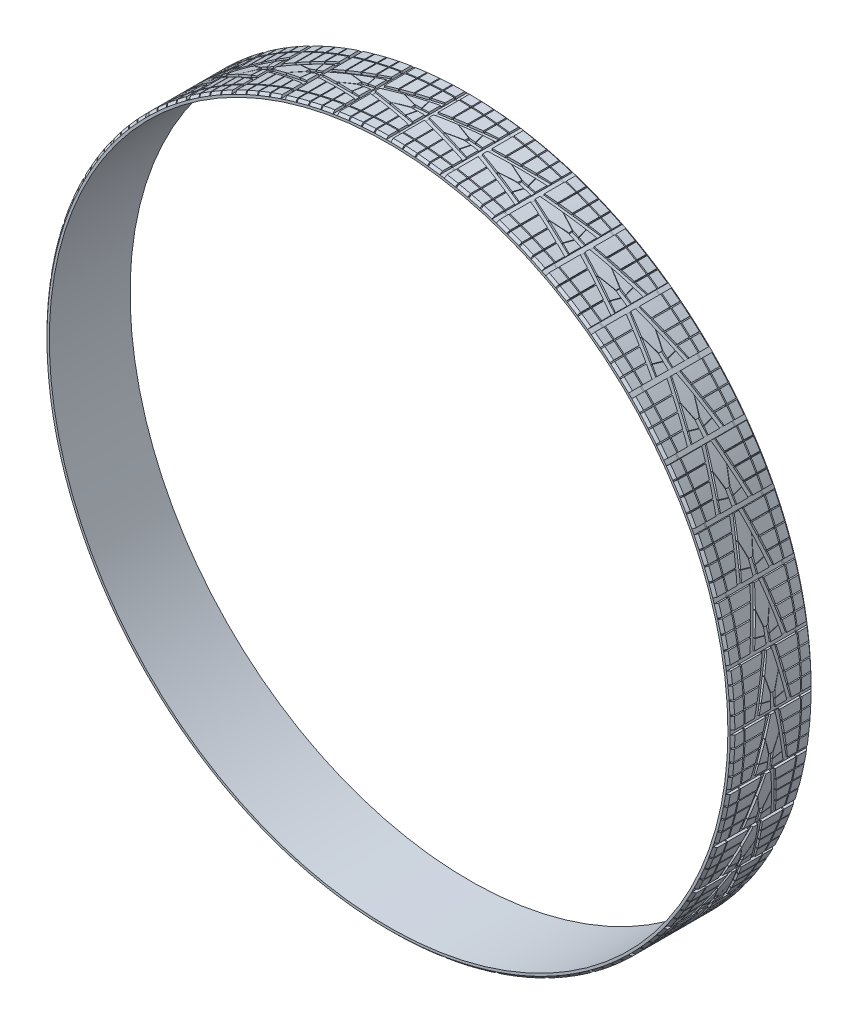
from build123d import *

# Parameters (mm, degrees)
SKETCH_1_R               = 149
SKETCH_1_R_2             = 147
EXTRUDE_1_DEPTH          = 35
CHAMFER_1_SIZE           = 1
SKETCH_2_W               = 2
SKETCH_2_H               = 2
CUT_EXTRUDE_1_DEPTH      = 214.604775228
SKETCH_3_R               = 149
SKETCH_3_R_2             = 148
CUT_EXTRUDE_2_DEPTH      = 0.5
CUT_EXTRUDE_START        = -0.5
SKETCH_4_R               = 149
SKETCH_4_R_2             = 148
CUT_EXTRUDE_3_DEPTH      = 0.5
SKETCH_5_W               = 6
SKETCH_5_H               = 2
CUT_EXTRUDE_4_DEPTH      = 1
CUT_EXTRUDE_5_DEPTH      = 1
PATTERN_CIRCULAR_1_COUNT = 40


with BuildPart() as part:
    # 草图1 → 拉伸-薄壁1 (new body)
    with BuildSketch(Plane.XY):
        Circle(SKETCH_1_R)
        Circle(SKETCH_1_R_2, mode=Mode.SUBTRACT)
    extrude(amount=EXTRUDE_1_DEPTH)

    # 倒角1
    chamfer_1_edges = [part.edges().sort_by_distance(p)[0] for p in [
        (-149, 0, 0),
        (-149, 0, 35),
    ]]
    chamfer(chamfer_1_edges, length=CHAMFER_1_SIZE)

    # 草图2 → 切除-拉伸1 (cut, through all)
    with BuildSketch(Plane(origin=(0, 0, 0), x_dir=(-1, 0, 0), z_dir=(0, 0, -1))):
        with Locations((0, 149)):
            Rectangle(SKETCH_2_W, SKETCH_2_H)
        Polygon((22.477481415, 148.309685554), (22.164612485, 146.334308873), (24.139989167, 146.021439943), (24.452858097, 147.996816624), align=None)
        Polygon((45.40149264, 142.967494439), (44.783458651, 141.065381406), (46.685571684, 140.447347417), (47.303605673, 142.34946045), align=None)
        Polygon((67.207568437, 134.104969128), (66.299587437, 132.32295608), (68.081600486, 131.41497508), (68.989581485, 133.196988129), align=None)
        Polygon((87.35877085, 121.940334409), (86.183200345, 120.32230042), (87.801234334, 119.146729915), (88.976804838, 120.764763904), align=None)
        Polygon((105.358910397, 106.773123959), (103.944696834, 105.358910397), (105.358910397, 103.944696834), (106.773123959, 105.358910397), align=None)
        Polygon((120.764763904, 88.976804838), (119.146729915, 87.801234334), (120.32230042, 86.183200345), (121.940334409, 87.35877085), align=None)
        Polygon((133.196988129, 68.989581485), (131.41497508, 68.081600486), (132.32295608, 66.299587437), (134.104969128, 67.207568437), align=None)
        Polygon((142.34946045, 47.303605673), (140.447347417, 46.685571684), (141.065381406, 44.783458651), (142.967494439, 45.40149264), align=None)
        Polygon((147.996816624, 24.452858097), (146.021439943, 24.139989167), (146.334308873, 22.164612485), (148.309685554, 22.477481415), align=None)
        with Locations((149, 0)):
            Rectangle(SKETCH_2_W, SKETCH_2_H)
        Polygon((148.309685554, -22.477481415), (146.334308873, -22.164612485), (146.021439943, -24.139989166), (147.996816624, -24.452858097), align=None)
        Polygon((142.967494439, -45.40149264), (141.065381406, -44.783458651), (140.447347417, -46.685571684), (142.34946045, -47.303605672), align=None)
        Polygon((134.104969128, -67.207568437), (132.32295608, -66.299587437), (131.41497508, -68.081600486), (133.196988129, -68.989581485), align=None)
        Polygon((121.940334409, -87.358770849), (120.32230042, -86.183200345), (119.146729915, -87.801234334), (120.764763904, -88.976804838), align=None)
        Polygon((106.773123959, -105.358910397), (105.358910397, -103.944696834), (103.944696835, -105.358910397), (105.358910397, -106.773123959), align=None)
        Polygon((88.976804838, -120.764763904), (87.801234334, -119.146729915), (86.183200345, -120.32230042), (87.35877085, -121.940334409), align=None)
        Polygon((68.989581485, -133.196988128), (68.081600486, -131.41497508), (66.299587437, -132.32295608), (67.207568437, -134.104969128), align=None)
        Polygon((47.303605673, -142.34946045), (46.685571684, -140.447347417), (44.783458651, -141.065381406), (45.40149264, -142.967494439), align=None)
        Polygon((24.452858097, -147.996816624), (24.139989167, -146.021439943), (22.164612485, -146.334308873), (22.477481416, -148.309685554), align=None)
        with Locations((0, -149)):
            Rectangle(SKETCH_2_W, SKETCH_2_H)
        Polygon((-22.477481415, -148.309685554), (-22.164612485, -146.334308873), (-24.139989166, -146.021439943), (-24.452858097, -147.996816624), align=None)
        Polygon((-45.40149264, -142.967494439), (-44.783458651, -141.065381406), (-46.685571684, -140.447347417), (-47.303605672, -142.34946045), align=None)
        Polygon((-67.207568437, -134.104969128), (-66.299587437, -132.32295608), (-68.081600486, -131.41497508), (-68.989581485, -133.196988129), align=None)
        Polygon((-87.358770849, -121.940334409), (-86.183200345, -120.32230042), (-87.801234334, -119.146729915), (-88.976804838, -120.764763904), align=None)
        Polygon((-105.358910397, -106.773123959), (-103.944696834, -105.358910397), (-105.358910397, -103.944696834), (-106.773123959, -105.358910397), align=None)
        Polygon((-120.764763904, -88.976804838), (-119.146729915, -87.801234334), (-120.32230042, -86.183200345), (-121.940334408, -87.35877085), align=None)
        Polygon((-133.196988128, -68.989581485), (-131.41497508, -68.081600486), (-132.32295608, -66.299587437), (-134.104969128, -67.207568437), align=None)
        Polygon((-142.34946045, -47.303605673), (-140.447347417, -46.685571684), (-141.065381406, -44.783458651), (-142.967494439, -45.40149264), align=None)
        Polygon((-147.996816624, -24.452858097), (-146.021439943, -24.139989167), (-146.334308873, -22.164612485), (-148.309685554, -22.477481415), align=None)
        with Locations((-149, 0)):
            Rectangle(SKETCH_2_W, SKETCH_2_H)
        Polygon((-148.309685554, 22.477481415), (-146.334308873, 22.164612485), (-146.021439943, 24.139989166), (-147.996816624, 24.452858097), align=None)
        Polygon((-142.967494439, 45.40149264), (-141.065381406, 44.783458651), (-140.447347417, 46.685571684), (-142.34946045, 47.303605672), align=None)
        Polygon((-134.104969128, 67.207568437), (-132.32295608, 66.299587437), (-131.41497508, 68.081600486), (-133.196988128, 68.989581485), align=None)
        Polygon((-121.940334409, 87.358770849), (-120.32230042, 86.183200345), (-119.146729915, 87.801234334), (-120.764763904, 88.976804838), align=None)
        Polygon((-106.773123959, 105.358910397), (-105.358910397, 103.944696834), (-103.944696834, 105.358910397), (-105.358910397, 106.773123959), align=None)
        Polygon((-88.976804838, 120.764763904), (-87.801234334, 119.146729915), (-86.183200345, 120.32230042), (-87.358770849, 121.940334409), align=None)
        Polygon((-68.989581485, 133.196988128), (-68.081600486, 131.41497508), (-66.299587437, 132.32295608), (-67.207568437, 134.104969128), align=None)
        Polygon((-47.303605673, 142.34946045), (-46.685571684, 140.447347417), (-44.783458651, 141.065381406), (-45.40149264, 142.967494439), align=None)
        Polygon((-24.452858097, 147.996816624), (-24.139989167, 146.021439943), (-22.164612485, 146.334308873), (-22.477481415, 148.309685554), align=None)
    extrude(amount=-CUT_EXTRUDE_1_DEPTH, mode=Mode.SUBTRACT)

    # 草图3 → 切除-拉伸2 (cut)
    with BuildSketch(Plane.XY.offset(5)):
        Circle(SKETCH_3_R)
        with Locations(Location((0, 0, 0), (0, 0, 180))):
            Circle(SKETCH_3_R_2, mode=Mode.SUBTRACT)
    extrude(amount=CUT_EXTRUDE_2_DEPTH, mode=Mode.SUBTRACT)

    # 草图4 → 切除-拉伸3 (cut)
    with BuildSketch(Plane.XY.offset(30).offset(CUT_EXTRUDE_START)):
        Circle(SKETCH_4_R)
        with Locations(Location((0, 0, 0), (0, 0, 180))):
            Circle(SKETCH_4_R_2, mode=Mode.SUBTRACT)
    extrude(amount=CUT_EXTRUDE_3_DEPTH, mode=Mode.SUBTRACT)

    # 草图5 → 切除-拉伸4 (cut, symmetric)
    with BuildSketch(Plane(origin=(148.582953793, -11.13475307, 0), x_dir=(0.07473009358642445, 0.9972037971811802, -1.0445155346644797e-14), z_dir=(0.9972037971811802, -0.07473009358642445, 7.765718859307269e-15))):
        Polygon((-11.248970339, 25.5), (10.137329372, 20.5), (10.137329372, 18.5), (-11.248970339, 23.5), align=None)
        Polygon((10.137329372, 16.5), (-11.248970339, 11.5), (-11.248970339, 9.5), (10.137329372, 14.5), align=None)
        with Locations((-8.248970339, 17.5)):
            Rectangle(SKETCH_5_W, SKETCH_5_H)
    cut_extrude_4 = extrude(amount=CUT_EXTRUDE_4_DEPTH, both=True, mode=Mode.SUBTRACT)

    # 草图6 → 切除-拉伸5 (cut, symmetric)
    with BuildSketch(Plane(origin=(148.582953793, -11.13475307, 0), x_dir=(0.07473009358642445, 0.9972037971811802, -1.0445155346644797e-14), z_dir=(0.9972037971811802, -0.07473009358642445, 7.765718859307269e-15))):
        Polygon((-5.248970339, 18.5), (1.475988707, 20.524974115), (1.670737055, 20.479443015), (-5.248970339, 18.3), align=None)
        Polygon((-8.248970339, 18.5), (-7.301176869, 22.577027461), (-7.106428521, 22.531496361), (-8.048970339, 18.5), align=None)
        Polygon((1.670737055, 14.520556985), (-5.248970339, 16.7), (-5.248970339, 16.5), (1.475988707, 14.475025885), align=None)
        Polygon((-7.106428521, 12.468503639), (-8.048970339, 16.5), (-8.248970339, 16.5), (-7.301176869, 12.422972539), align=None)
        Polygon((4.751029661, 35), (4.751029661, 21.759287437), (5.251029661, 21.64239017), (5.251029661, 35), align=None)
        Polygon((-5.748970339, 35), (-5.748970339, 24.214130057), (-6.248970339, 24.331027324), (-6.248970339, 35), align=None)
        Polygon((-0.748970339, 35), (-0.748970339, 23.045157381), (-0.248970339, 22.928260113), (-0.248970339, 35), align=None)
        Polygon((-0.748970339, 11.954842619), (-0.248970339, 12.071739887), (-0.248970339, 0), (-0.748970339, 0), align=None)
        Polygon((-6.248970339, 10.668972676), (-6.248970339, 0), (-5.748970339, 0), (-5.748970339, 10.785869943), align=None)
        Polygon((4.751029661, 0), (4.751029661, 13.240712563), (5.251029661, 13.35760983), (5.251029661, 0), align=None)
    cut_extrude_5 = extrude(amount=CUT_EXTRUDE_5_DEPTH, both=True, mode=Mode.SUBTRACT)

    # 阵列(圆周)1: 切除-拉伸4, 切除-拉伸5 ×40 about axis
    pattern_circular_1_axis = Axis((0, 0, 0), (0, 0, 1))
    add([cut_extrude_4.rotate(pattern_circular_1_axis, i * 360 / PATTERN_CIRCULAR_1_COUNT) for i in range(1, PATTERN_CIRCULAR_1_COUNT)], mode=Mode.SUBTRACT)
    add([cut_extrude_5.rotate(pattern_circular_1_axis, i * 360 / PATTERN_CIRCULAR_1_COUNT) for i in range(1, PATTERN_CIRCULAR_1_COUNT)], mode=Mode.SUBTRACT)


solid = part.part
